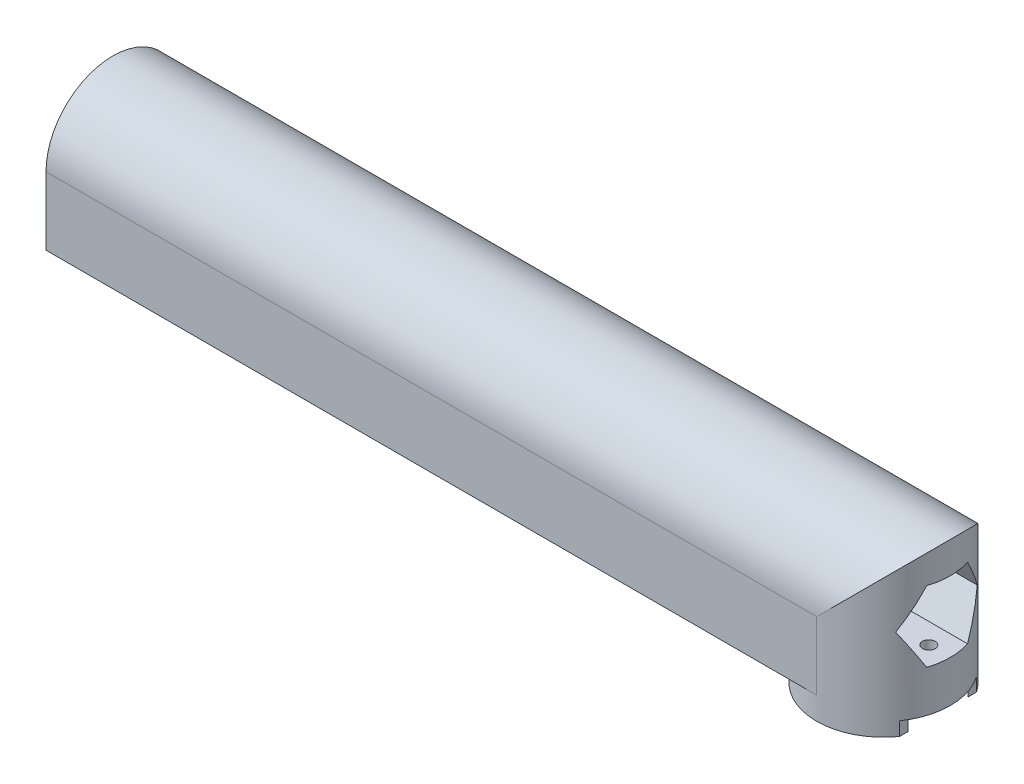
from build123d import *

# Parameters (mm, degrees)
ESQUISSE1_R             = 14.75
BOSS_EXTRU_1_DEPTH      = 5
ESQUISSE2_R             = 13.75
ENL_V_MAT_EXTRU_1_DEPTH = 3
ENL_V_MAT_EXTRU_2_DEPTH = 3
ESQUISSE5_R             = 14.75
BOSS_EXTRU_2_DEPTH      = 30
ENL_V_START             = -30
ENL_V_MAT_EXTRU_6_DEPTH = 30
ENL_V_MAT_EXTRU_7_DEPTH = 15
BOSS_EXTRU_3_START      = 170
BOSS_EXTRU_3_DEPTH      = 170
ENL_V_MAT_EXTRU_8_DEPTH = 189.567461403
ESQUISSE6_R             = 1.4
ENL_V_MAT_EXTRU_5_DEPTH = 10


with BuildPart() as part:
    # Esquisse1 → Boss.-Extru.1 (new body)
    with BuildSketch(Plane(origin=(0, 0, 0), x_dir=(1, 0, 0), z_dir=(0, 1, 0))):
        Circle(ESQUISSE1_R)
    extrude(amount=BOSS_EXTRU_1_DEPTH)

    # Esquisse2 → Enlèv. mat.-Extru.1 (cut)
    with BuildSketch(Plane.XZ):
        Circle(ESQUISSE2_R)
    extrude(amount=-ENL_V_MAT_EXTRU_1_DEPTH, mode=Mode.SUBTRACT)

    # Esquisse3 → Enlèv. mat.-Extru.2 (cut)
    with BuildSketch(Plane.XZ):
        with BuildLine():
            Line((-12.054563451, 8.5), (-12.054563451, -8.5))
            ThreePointArc((-12.054563451, -8.5), (-14.75, 0), (-12.054563451, 8.5))
        make_face()
        with BuildLine():
            Line((12.054563451, 8.5), (12.054563451, -8.5))
            ThreePointArc((12.054563451, -8.5), (14.75, 0), (12.054563451, 8.5))
        make_face()
    extrude(amount=-ENL_V_MAT_EXTRU_2_DEPTH, mode=Mode.SUBTRACT)

    # Esquisse5 → Boss.-Extru.2 (add)
    with BuildSketch(Plane(origin=(0, 5, 0), x_dir=(1, 0, 0), z_dir=(0, 1, 0))):
        Circle(ESQUISSE5_R)
    extrude(amount=BOSS_EXTRU_2_DEPTH)

    # Esquisse7 → Enlèv. mat.-Extru.6 (cut)
    with BuildSketch(Plane(origin=(0, 35, 0), x_dir=(1, 0, 0), z_dir=(0, 1, 0)).offset(ENL_V_START)):
        with BuildLine():
            Line((0, -14.75), (0, 14.75))
            ThreePointArc((0, 14.75), (-14.75, 0), (0, -14.75))
        make_face()
    extrude(amount=ENL_V_MAT_EXTRU_6_DEPTH, mode=Mode.SUBTRACT)

    # Esquisse8 → Enlèv. mat.-Extru.7 (cut)
    with BuildSketch(Plane.ZY):
        with BuildLine():
            Line((-14.75, 20), (-14.75, 35))
            Line((-14.75, 35), (14.75, 35))
            Line((14.75, 35), (14.75, 20))
            ThreePointArc((14.75, 20), (0, 34.75), (-14.75, 20))
        make_face()
    extrude(amount=-ENL_V_MAT_EXTRU_7_DEPTH, mode=Mode.SUBTRACT)

    # Esquisse10 → Boss.-Extru.3 (add)
    with BuildSketch(Plane.ZY.offset(BOSS_EXTRU_3_START)):
        with BuildLine():
            Line((-14.75, 20), (-14.75, 5))
            Line((-14.75, 5), (14.75, 5))
            Line((14.75, 5), (14.75, 20))
            ThreePointArc((14.75, 20), (0, 34.75), (-14.75, 20))
        make_face()
    extrude(amount=-BOSS_EXTRU_3_DEPTH)

    # Esquisse11 → Enlèv. mat.-Extru.8 (cut, through all)
    with BuildSketch(Plane.ZY.offset(170)):
        Polygon((-4.5, 27.794228634), (-9, 20), (-4.5, 12.205771366), (4.5, 12.205771366), (9, 20), (4.5, 27.794228634), align=None)
    extrude(amount=-ENL_V_MAT_EXTRU_8_DEPTH, mode=Mode.SUBTRACT)

    # Esquisse6 → Enlèv. mat.-Extru.5 (cut)
    with BuildSketch(Plane.XZ.offset(-3)):
        with Locations((0, 10)):
            Circle(ESQUISSE6_R)
        with Locations((7.071067812, 7.071067812)):
            Circle(ESQUISSE6_R)
        with Locations((10, 0)):
            Circle(ESQUISSE6_R)
        with Locations((7.071067812, -7.071067812)):
            Circle(ESQUISSE6_R)
        with Locations((0, -10)):
            Circle(ESQUISSE6_R)
        with Locations((-7.071067812, -7.071067812)):
            Circle(ESQUISSE6_R)
        with Locations((-10, 0)):
            Circle(ESQUISSE6_R)
        with Locations((-7.071067812, 7.071067812)):
            Circle(ESQUISSE6_R)
    extrude(amount=-ENL_V_MAT_EXTRU_5_DEPTH, mode=Mode.SUBTRACT)


solid = part.part
